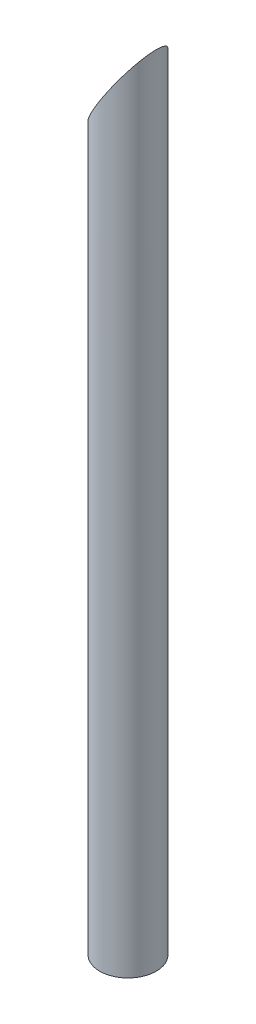
from build123d import *

# Parameters (mm, degrees)
SKETCH1_R           = 3.5052
BOSS_EXTRUDE1_DEPTH = 99.0092
CUT_EXTRUDE1_DEPTH  = 49.5046
SKETCH3_R           = 3.175
CUT_EXTRUDE2_DEPTH  = 76.2
SKETCH4_R           = 2.5019
CUT_EXTRUDE3_DEPTH  = 76.2
SKETCH6_R           = 3.429
CUT_EXTRUDE4_DEPTH  = 76.2
THREAD1_PITCH       = 0.79375


with BuildPart() as part:
    # Sketch1 → Boss-Extrude1 (new body)
    with BuildSketch(Plane(origin=(0, 0, 0), x_dir=(1, 0, 0), z_dir=(0, 1, 0))):
        with Locations(Location((0, 0, 0), (0, 0, 270))):
            Circle(SKETCH1_R)
    extrude(amount=BOSS_EXTRUDE1_DEPTH)

    # Sketch2 → Cut-Extrude1 (cut, symmetric)
    with BuildSketch(Plane.XY):
        Polygon((-3.5052, 88.011), (3.5052, 99.0092), (-3.5052, 99.0092), align=None)
    extrude(amount=CUT_EXTRUDE1_DEPTH, both=True, mode=Mode.SUBTRACT)

    # Sketch3 → Cut-Extrude2 (cut)
    with BuildSketch(Plane.XZ):
        with Locations(Location((0, 0, 0), (0, 0, 270))):
            Circle(SKETCH3_R)
    extrude(amount=-CUT_EXTRUDE2_DEPTH, mode=Mode.SUBTRACT)

    # Sketch4 → Cut-Extrude3 (cut)
    with BuildSketch(Plane.XZ.offset(-76.2)):
        with Locations(Location((0, 0, 0), (0, 0, 270))):
            Circle(SKETCH4_R)
    extrude(amount=-CUT_EXTRUDE3_DEPTH, mode=Mode.SUBTRACT)

    # Sketch6 → Cut-Extrude4 (cut)
    with BuildSketch(Plane(origin=(0, 81.28, 0), x_dir=(1, 0, 0), z_dir=(0, 1, 0))):
        with Locations(Location((0, 0, 0), (0, 0, 180))):
            Circle(SKETCH6_R)
    extrude(amount=CUT_EXTRUDE4_DEPTH, mode=Mode.SUBTRACT)

    # Thread1: the profile of Thread Profile1 profile screwed along a right-hand helix of 6.976 turns, 8 arcs to a turn; built about Z, then put on its axis
    thread1_z = Axis((0, 0, 0), (0, 0, 1))
    thread1_corners = [(3.1753, 0, -0.000173205), (3.1753, 0, 0.277985704), (3.003148085, 0, 0.17859375), (3.003148085, 0, 0.09921875)]
    with BuildLine(mode=Mode.PRIVATE) as thread1_profile:
        Line(thread1_corners[0], thread1_corners[1])
        Line(thread1_corners[1], thread1_corners[2])
        Line(thread1_corners[2], thread1_corners[3])
        Line(thread1_corners[3], thread1_corners[0])
    thread1_cap = Face(thread1_profile.wire())
    thread1_turn_angles = [0, 22.5, 45, 67.5, 90, 112.5, 135, 157.5, 180, 202.5, 225, 247.5, 270, 292.5, 315, 337.5, 360]
    thread1_turn_weights = [1, 0.9238795325112867, 1, 0.9238795325112867, 1, 0.9238795325112867, 1, 0.9238795325112867, 1, 0.9238795325112867, 1, 0.9238795325112867, 1, 0.9238795325112867, 1, 0.9238795325112867, 1]
    thread1_turn_rails = [Edge.make_bspline([Vector(p[0], p[1], 0).rotate(thread1_z, thread1_turn_angles[k]) / thread1_turn_weights[k] + Vector(0, 0, p[2] + THREAD1_PITCH * thread1_turn_angles[k] / 360) for k in range(17)], [0, 0, 0, 1, 1, 2, 2, 3, 3, 4, 4, 5, 5, 6, 6, 7, 7, 8, 8, 8], 2, thread1_turn_weights) for p in thread1_corners]
    thread1_turn_sides = [Face.make_surface_from_curves(thread1_turn_rails[p[0]], thread1_turn_rails[p[1]]) for p in [(0, 1), (1, 2), (2, 3), (3, 0)]]
    thread1_last_angles = [2160, 2182.5, 2205, 2227.5, 2250, 2272.5, 2295, 2317.5, 2340, 2362.5, 2385, 2407.5, 2430, 2452.5, 2475, 2493.18, 2511.36]
    thread1_last_weights = [1, 0.9238795325112867, 1, 0.9238795325112867, 1, 0.9238795325112867, 1, 0.9238795325112867, 1, 0.9238795325112867, 1, 0.9238795325112867, 1, 0.9238795325112867, 1, 0.9500810191007714, 1]
    thread1_last_rails = [Edge.make_bspline([Vector(p[0], p[1], 0).rotate(thread1_z, thread1_last_angles[k]) / thread1_last_weights[k] + Vector(0, 0, p[2] + THREAD1_PITCH * thread1_last_angles[k] / 360) for k in range(17)], [0, 0, 0, 1, 1, 2, 2, 3, 3, 4, 4, 5, 5, 6, 6, 7, 7, 8, 8, 8], 2, thread1_last_weights) for p in thread1_corners]
    thread1_last_sides = [Face.make_surface_from_curves(thread1_last_rails[p[0]], thread1_last_rails[p[1]]) for p in [(0, 1), (1, 2), (2, 3), (3, 0)]]
    thread1 = Plane(origin=(0, 0, 0), x_dir=(1, 0, 0), z_dir=(0, 1, 0)) * Solid(Shell([*[p.moved(Location((0, 0, THREAD1_PITCH * i))) for i in range(6) for p in thread1_turn_sides], *thread1_last_sides, thread1_cap, thread1_cap.rotate(thread1_z, 2511.36).moved(Location((0, 0, THREAD1_PITCH * 2511.36 / 360)))]))
    add(thread1)


solid = part.part
